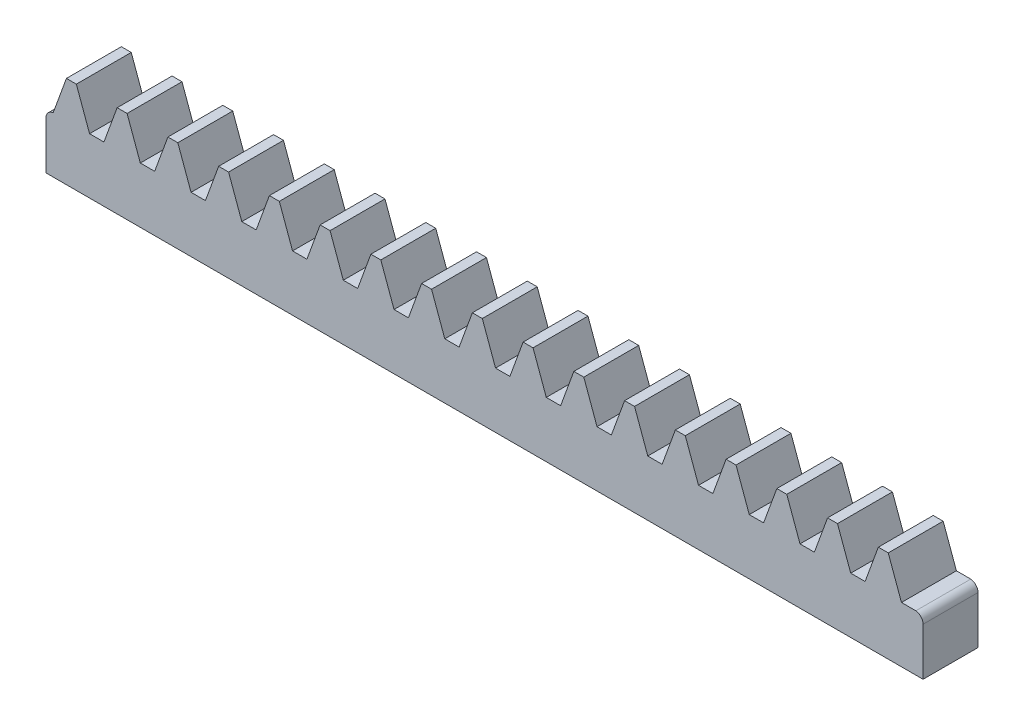
from build123d import *

# Parameters (mm, degrees)
BLANKSKE_W        = 54.3
BLANKSKE_H        = 5.7
BLANK_DEPTH       = 3.4
TOOTHCUTSIM_DEPTH = 55.704113191
TEETHCUTS_COUNT   = 18
TEETHCUTS_PITCH   = 3.14159265
VERRUNDUNG1_R     = 0.5
VERRUNDUNG2_R     = 0.5


with BuildPart() as part:
    # BlankSke → Blank (new body)
    with BuildSketch(Plane.XY):
        with Locations((27.15, 2.85)):
            Rectangle(BLANKSKE_W, BLANKSKE_H)
    extrude(amount=-BLANK_DEPTH)

    # TooCutSkeSim → ToothCutSim (cut, through all)
    with BuildSketch(Plane.XY):
        Polygon((0.44443537, 3.45), (-0.44443537, 3.45), (-1.272613241, 5.7254), (1.272613241, 5.7254), align=None)
    toothcutsim = extrude(amount=-TOOTHCUTSIM_DEPTH, mode=Mode.SUBTRACT)

    # TeethCuts: ToothCutSim ×18
    with Locations(*[(i * TEETHCUTS_PITCH, 0, 0) for i in range(1, TEETHCUTS_COUNT)]):
        add(toothcutsim, mode=Mode.SUBTRACT)

    # Verrundung1
    # the kernel refuses this fillet: 0.5 mm, written as the material it takes off along each edge
    with BuildSketch(Plane(origin=(54.3, 4.682214995, -7.723886484), x_dir=(0, -1, 0), z_dir=(0, 0, 1))) as verrundung1_piece_1:
        with BuildLine():
            CenterArc((1.729554594, -0.5), VERRUNDUNG1_R, 90, 84.086849411)
            Line((1.232214995, -0.44848958), (1.222268203, -0.447459372))
            ThreePointArc((1.222268203, -0.447459372), (0.612687296, -0.233641716), (-0.003420201, -0.009396926))
            Line((-0.003420201, -0.009396926), (0, 0.01))
            Line((0, 0.01), (1.729554594, 0.01))
            Line((1.729554594, 0.01), (1.729554594, 0))
        make_face()
    extrude(amount=12.047772969, mode=Mode.SUBTRACT)

    # Verrundung2
    # the kernel refuses this fillet: 0.5 mm, written as the material it takes off along each edge
    with BuildSketch(Plane(origin=(0, 3.45, 1.242257451), x_dir=(0, -1, 0), z_dir=(0, 0, -1))) as verrundung2_piece_1:
        with BuildLine():
            CenterArc((0.49690298, -0.5), VERRUNDUNG2_R, 90, 83.619583418)
            Line((0, -0.44443537), (-0.00993806, -0.443324077))
            ThreePointArc((-0.00993806, -0.443324077), (-0.01, -0.222217685), (-0.01, 0))
            Line((-0.01, 0), (0, 0.01))
            Line((0, 0.01), (0.49690298, 0.01))
            Line((0.49690298, 0.01), (0.49690298, 0))
        make_face()
    extrude(amount=5.884514902, mode=Mode.SUBTRACT)


solid = part.part
